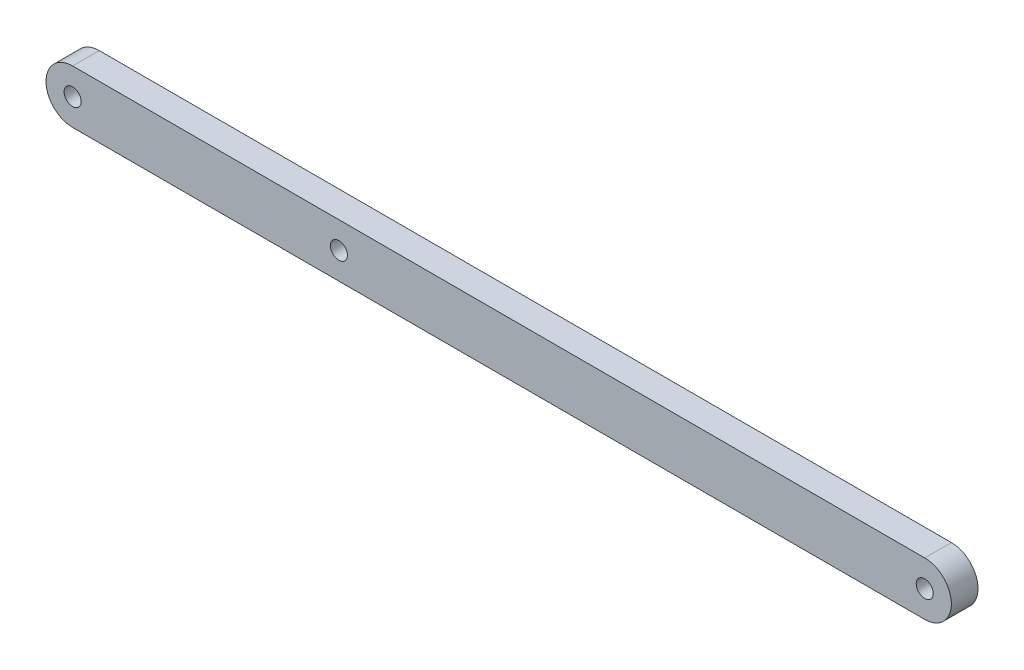
from build123d import *

# Parameters (mm, degrees)
SKETCH2_R           = 2.032
BOSS_EXTRUDE1_DEPTH = 3.175


with BuildPart() as part:
    # Sketch2 → Boss-Extrude1 (new, symmetric)
    with BuildSketch(Plane.XY):
        with BuildLine():
            Line((0, 6.35), (203.2, 6.35))
            ThreePointArc((203.2, 6.35), (209.55, 0), (203.2, -6.35))
            Line((203.2, -6.35), (0, -6.35))
            ThreePointArc((0, -6.35), (-6.35, 0), (0, 6.35))
        make_face()
        Circle(SKETCH2_R, mode=Mode.SUBTRACT)
        with Locations((203.2, 0)):
            Circle(SKETCH2_R, mode=Mode.SUBTRACT)
        with Locations((63.5, 0)):
            Circle(SKETCH2_R, mode=Mode.SUBTRACT)
    extrude(amount=BOSS_EXTRUDE1_DEPTH, both=True)


solid = part.part
